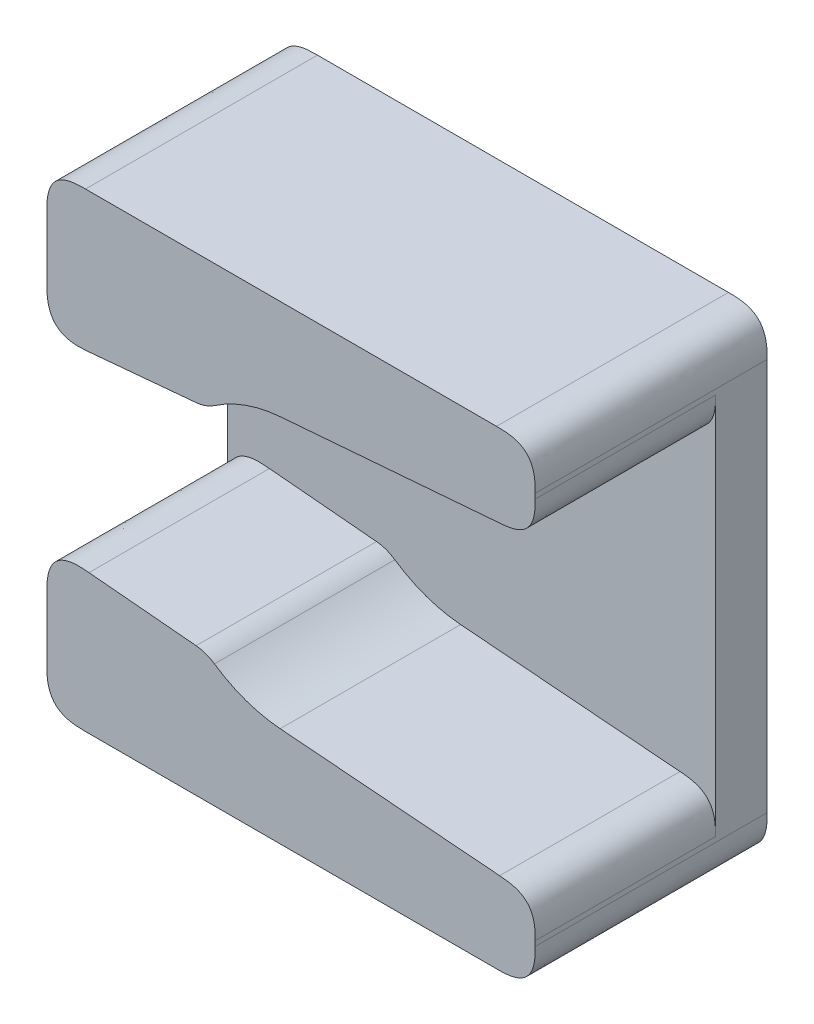
from build123d import *

# Parameters (mm, degrees)
SKETCH2_W           = 94.751202958
SKETCH2_H           = 91.163886598
BOSS_EXTRUDE1_DEPTH = 45
CUT_EXTRUDE3_DEPTH  = 35
FILLET2_SIZE        = 7.5
FILLET3_R           = 7.5


with BuildPart() as part:
    # Sketch2 → Boss-Extrude1 (new body)
    with BuildSketch(Plane.XY):
        with Locations((-304.121373084, 372.346881372)):
            Rectangle(SKETCH2_W, SKETCH2_H)
    extrude(amount=BOSS_EXTRUDE1_DEPTH)

    # Sketch5 → Cut-Extrude3 (cut)
    with BuildSketch(Plane.XY.offset(45)):
        with BuildLine():
            Line((-371.329773575, 356.337977129), (-320.45664172, 351.735015891))
            ThreePointArc((-320.45664172, 351.735015891), (-313.755539426, 347.87500284), (-306.221453805, 346.130862205))
            Line((-306.221453805, 346.130862205), (-238.931197352, 340.740456843))
            Line((-238.931197352, 340.740456843), (-238.931197352, 403.953305901))
            Line((-238.931197352, 403.953305901), (-306.221453805, 398.562900539))
            ThreePointArc((-306.221453805, 398.562900539), (-313.755539426, 396.818759904), (-320.45664172, 392.958746853))
            Line((-320.45664172, 392.958746853), (-371.329773575, 388.355785615))
            Line((-371.329773575, 388.355785615), (-371.329773575, 356.337977129))
        make_face()
    extrude(amount=-CUT_EXTRUDE3_DEPTH, mode=Mode.SUBTRACT)

    # Fillet2
    # a fillet whose section is not a circle: 7.5 mm, written as the material it takes off along each edge
    with BuildSketch(Plane(origin=(-351.496974563, 326.764938073, -18.75), x_dir=(0, 1, 0), z_dir=(0, 0, 1)), Plane(origin=(-351.496974563, 417.928824671, -18.75), x_dir=(1, 0, 0), z_dir=(0, 0, 1))) as fillet2_piece_1:
        with BuildLine():
            add(Edge.make_bspline([(FILLET2_SIZE, 0), (6.238514613, 0), (4.977029227, 0), (2.196699141, -0.537689399), (0.537689399, -2.196699141), (0, -4.977029227), (0, -6.238514613), (0, -FILLET2_SIZE)], knots=[0, 0, 0, 0, 0, 0, 0.5, 0.5, 1, 1, 1, 1, 1, 1], degree=5))
            Line((0, -FILLET2_SIZE), (0, 0))
            Line((0, 0), (FILLET2_SIZE, 0))
        make_face()
    extrude(amount=82.5, mode=Mode.SUBTRACT)
    with BuildSketch(Plane(origin=(-351.496974563, 354.543520964, 10), x_dir=(0, -1, 0), z_dir=(0, 0, 1)), Plane(origin=(-351.496974563, 390.15024178, 65.523077256), x_dir=(0, 1, 0), z_dir=(0, 0, -1))) as fillet2_piece_2:
        with BuildLine():
            add(Edge.make_bspline([(8.209230902, 0), (6.849526251, 0), (5.4898216, 0), (2.507242029, 0.618786495), (0.842199494, 2.441282313), (0.494693995, 5.467487453), (0.617218509, 6.821660441), (0.739743023, 8.17583343)], knots=[0, 0, 0, 0, 0, 0, 0.5, 0.5, 1, 1, 1, 1, 1, 1], degree=5))
            Line((0.739743023, 8.17583343), (0, 0))
            Line((0, 0), (8.209230902, 0))
        make_face()
    extrude(amount=55.523077256, mode=Mode.SUBTRACT)
    with BuildSketch(Plane(origin=(-256.745771605, 417.928824671, -18.75), x_dir=(-1, 0, 0), z_dir=(0, 0, 1)), Plane(origin=(-256.745771605, 326.764938073, -18.75), x_dir=(0, 1, 0), z_dir=(0, 0, 1))) as fillet2_piece_3:
        with BuildLine():
            add(Edge.make_bspline([(FILLET2_SIZE, 0), (6.238514613, 0), (4.977029227, 0), (2.196699141, 0.537689399), (0.537689399, 2.196699141), (0, 4.977029227), (0, 6.238514613), (0, FILLET2_SIZE)], knots=[0, 0, 0, 0, 0, 0, 0.5, 0.5, 1, 1, 1, 1, 1, 1], degree=5))
            Line((0, FILLET2_SIZE), (0, 0))
            Line((0, 0), (FILLET2_SIZE, 0))
        make_face()
    extrude(amount=82.5, mode=Mode.SUBTRACT)
    with BuildSketch(Plane(origin=(-256.745771605, 342.167524916, 62.308062051), x_dir=(0, -1, 0), z_dir=(0, 0, -1)), Plane(origin=(-256.745771605, 402.526237828, 10), x_dir=(0, 1, 0), z_dir=(0, 0, 1))) as fillet2_piece_4:
        with BuildLine():
            add(Edge.make_bspline([(6.923224821, 0), (5.744187381, 0), (4.565149942, 0), (1.957575936, 0.472170808), (0.314348726, 1.989028329), (-0.364531688, 4.550572562), (-0.45867898, 5.725845114), (-0.552826273, 6.901117665)], knots=[0, 0, 0, 0, 0, 0, 0.5, 0.5, 1, 1, 1, 1, 1, 1], degree=5))
            Line((-0.552826273, 6.901117665), (0, 0))
            Line((0, 0), (6.923224821, 0))
        make_face()
    extrude(amount=52.308062051, mode=Mode.SUBTRACT)

    # Fillet3
    fillet3_edges = [part.edges().sort_by_distance(p)[0] for p in [
        (-320.45664172, 351.735015891, 27.5),
        (-320.45664172, 392.958746853, 27.5),
    ]]
    fillet(fillet3_edges, radius=FILLET3_R)


solid = part.part
